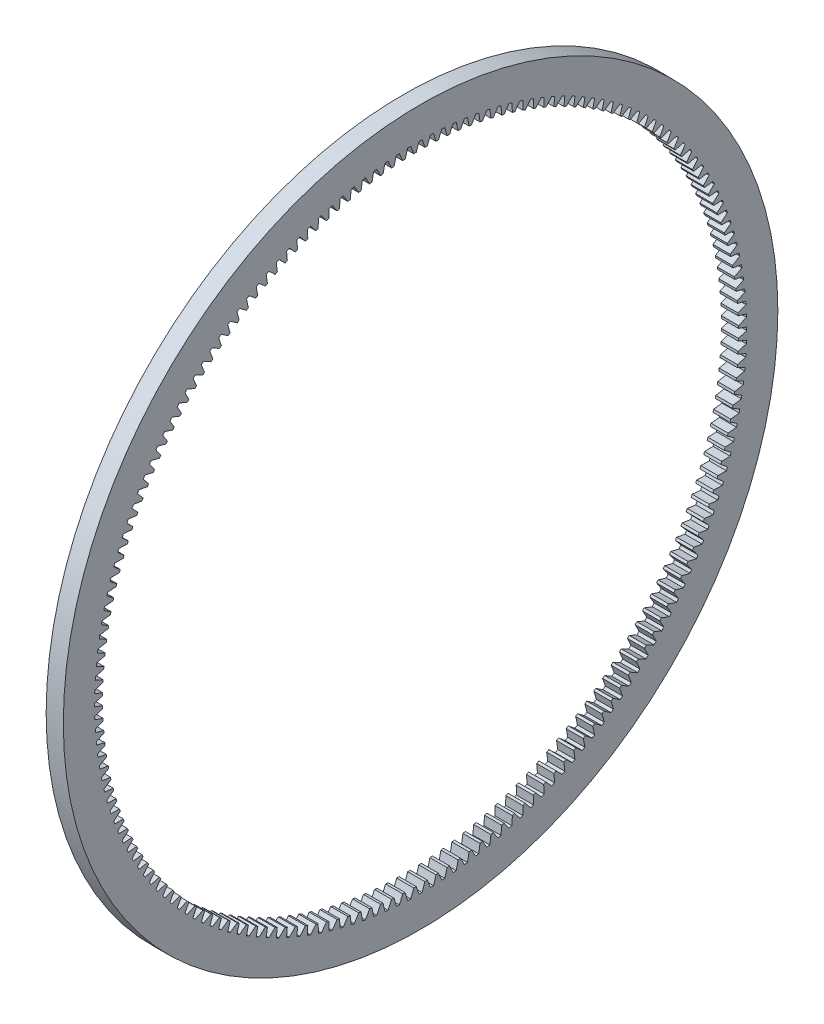
from build123d import *

# Parameters (mm, degrees)
BASPROSKE_W     = 12
BASPROSKE_H     = 27.5
TOOTHCUT_DEPTH  = 354.75697873
TEETHCUTS_COUNT = 180
TEETHCUTS_ANGLE = 358


with BuildPart() as part:
    # BasProSke → Base-Revolve (revolve)
    with BuildSketch(Plane(origin=(0, 0, 0), x_dir=(1, 0, 0), z_dir=(0, 1, 0)), mode=Mode.PRIVATE) as base_revolve_sk:
        with Locations((6, 236.25)):
            Rectangle(BASPROSKE_W, BASPROSKE_H)
    revolve(base_revolve_sk.sketch.rotate(Axis((-10, 0, 0), (1, 0, 0)), 180), axis=Axis((-10, 0, 0), (1, 0, 0)))

    # TooCutSke → ToothCut (cut, through all)
    with BuildSketch(Plane(origin=(0, 0, 0), x_dir=(0, 0, -1), z_dir=(1, 0, 0))):
        with BuildLine():
            ThreePointArc((3.016878197, 222.454143794), (2.073291875, 225.301940746), (1.054105282, 228.123564627))
            ThreePointArc((1.054105282, 228.123564627), (0, 228.126), (-1.054105282, 228.123564627))
            ThreePointArc((-1.054105282, 228.123564627), (-2.073291875, 225.301940746), (-3.016878197, 222.454143794))
            ThreePointArc((-3.016878197, 222.454143794), (0, 222.4746), (3.016878197, 222.454143794))
        make_face()
    toothcut = extrude(amount=TOOTHCUT_DEPTH, mode=Mode.SUBTRACT)

    # TeethCuts: ToothCut ×180 about axis
    teethcuts_axis = Axis((-10, 0, 0), (1, 0, 0))
    for i in range(1, TEETHCUTS_COUNT):
        add(toothcut.rotate(teethcuts_axis, i * TEETHCUTS_ANGLE / (TEETHCUTS_COUNT - 1)), mode=Mode.SUBTRACT)


solid = part.part
